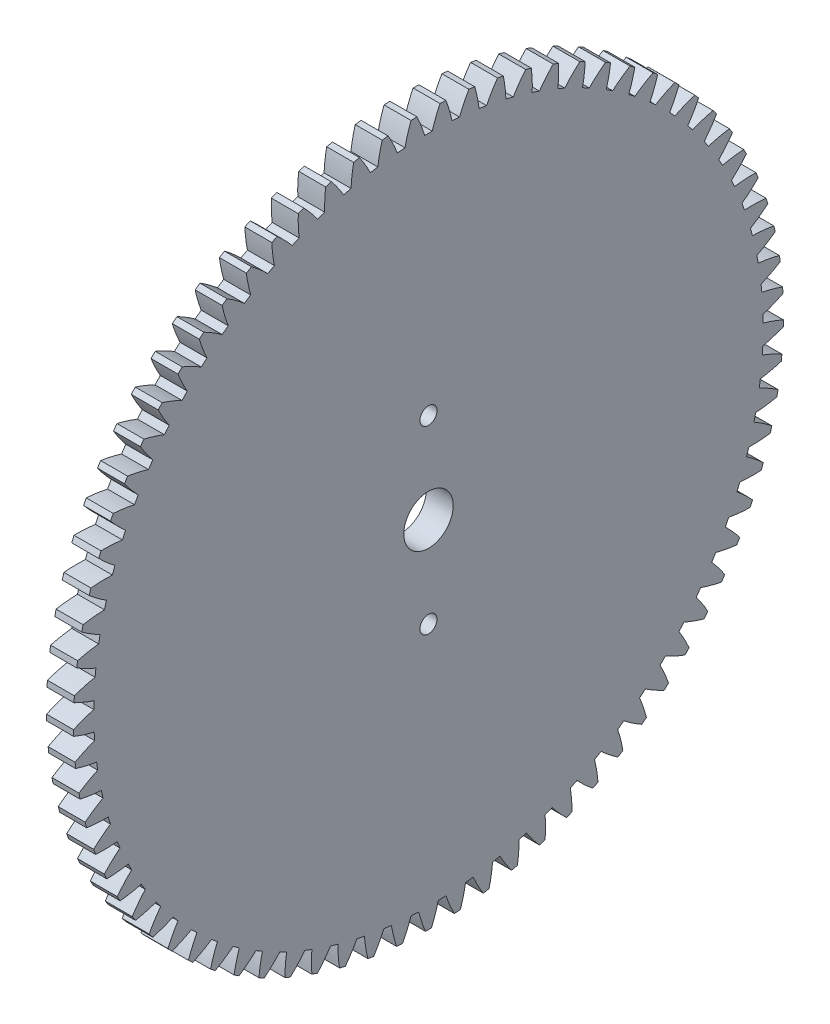
from build123d import *

# Parameters (mm, degrees)
BASPROSKE_W     = 2
BASPROSKE_H     = 39.5
TOOTHCUT_DEPTH  = 56.897227123
TEETHCUTS_COUNT = 77
TEETHCUTS_ANGLE = 355.324675325
BORSKE_R        = 2.75
BORSKE_R_2      = 0.95
BORE_DEPTH      = 50.0000508
SCALE1_SCALE_X  = 1.5
SCALE1_SCALE_Y  = 1
SCALE1_SCALE_Z  = 1


with BuildPart() as part:
    # BasProSke → Base-Revolve (revolve)
    with BuildSketch(Plane(origin=(0, 0, 0), x_dir=(1, 0, 0), z_dir=(0, 1, 0))):
        with Locations((1, 19.75)):
            Rectangle(BASPROSKE_W, BASPROSKE_H)
    revolve(axis=Axis((-10, 0, 0), (1, 0, 0)))

    # TooCutSke → ToothCut (cut, through all)
    with BuildSketch(Plane(origin=(0, 0, 0), x_dir=(0, 0, -1), z_dir=(1, 0, 0))):
        with BuildLine():
            ThreePointArc((0.421689506, 37.246612986), (0, 37.249), (-0.421689506, 37.246612986))
            ThreePointArc((-0.421689506, 37.246612986), (-0.813577504, 38.392577583), (-1.294307305, 39.504202482))
            ThreePointArc((-1.294307305, 39.504202482), (0, 39.5254), (1.294307305, 39.504202482))
            ThreePointArc((1.294307305, 39.504202482), (0.813577504, 38.392577583), (0.421689506, 37.246612986))
        make_face()
    toothcut = extrude(amount=TOOTHCUT_DEPTH, mode=Mode.SUBTRACT)

    # TeethCuts: ToothCut ×77 about axis
    teethcuts_axis = Axis((-10, 0, 0), (1, 0, 0))
    for i in range(1, TEETHCUTS_COUNT):
        add(toothcut.rotate(teethcuts_axis, i * TEETHCUTS_ANGLE / (TEETHCUTS_COUNT - 1)), mode=Mode.SUBTRACT)

    # BorSke → Bore (cut, symmetric)
    with BuildSketch(Plane(origin=(0, 0, 0), x_dir=(0, 0, -1), z_dir=(1, 0, 0))):
        Circle(BORSKE_R)
        with Locations((0, -10.05)):
            Circle(BORSKE_R_2)
        with Locations((0, 10.05)):
            Circle(BORSKE_R_2)
    extrude(amount=BORE_DEPTH, both=True, mode=Mode.SUBTRACT)


with BuildPart() as part_1:
    # Scale1: scaled about (1, 0, 0)
    add(part.part.scale((SCALE1_SCALE_X, SCALE1_SCALE_Y, SCALE1_SCALE_Z), about=(1, 0, 0)))


solid = part_1.part
